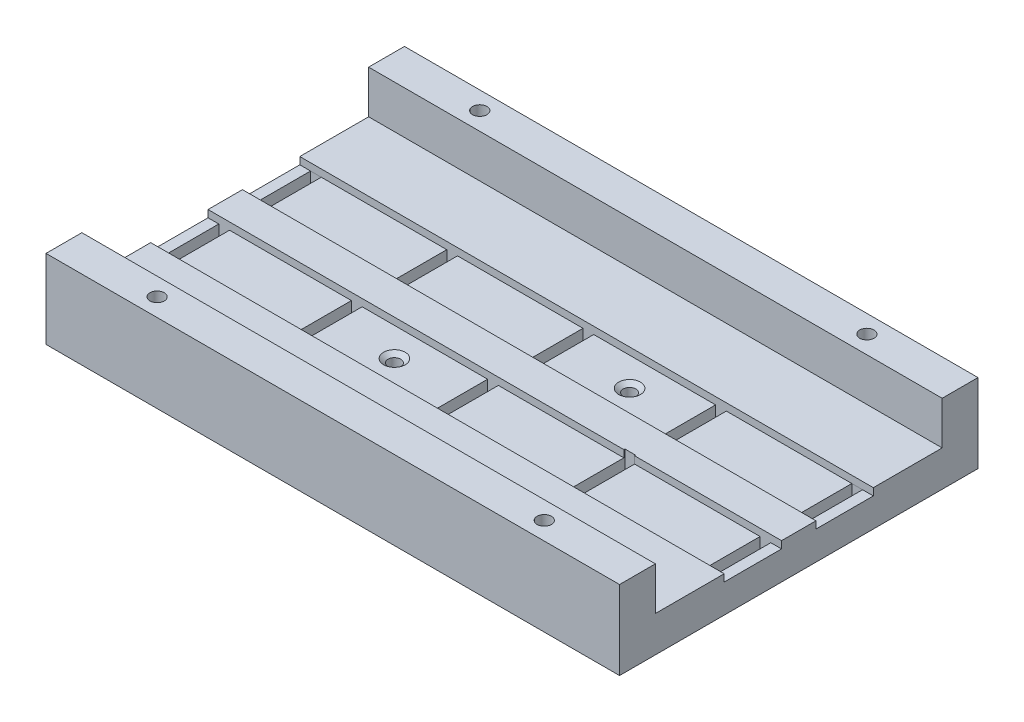
from build123d import *

# Parameters (mm, degrees)
SKETCH1_W                                         = 80
SKETCH1_H                                         = 50
BOSS_EXTRUDE2_DEPTH                               = 5
SKETCH2_W                                         = 80
SKETCH2_H                                         = 5
BOSS_EXTRUDE3_DEPTH                               = 6
SKETCH3_W                                         = 80
SKETCH3_H                                         = 8
CUT_EXTRUDE1_DEPTH                                = 1
CSK_FOR_0_FLAT_HEAD_MACHINE_SCREW_100_D           = 1.778
CSK_FOR_0_FLAT_HEAD_MACHINE_SCREW_100_CSINK_D     = 3.0226
CSK_FOR_0_FLAT_HEAD_MACHINE_SCREW_100_CSINK_ANGLE = 100
SKETCH14_W                                        = 1.5
SKETCH14_H                                        = 8.012608664
SKETCH14_H_2                                      = 8
CUT_EXTRUDE3_DEPTH                                = 10
SKETCH16_R                                        = 1
CUT_EXTRUDE4_DEPTH                                = 15
SKETCH18_W                                        = 1.5
SKETCH18_H                                        = 8
CUT_EXTRUDE5_DEPTH                                = 15
SKETCH19_W                                        = 1.5
SKETCH19_H                                        = 8.001374606
SKETCH19_H_2                                      = 8
CUT_EXTRUDE6_DEPTH                                = 15


with BuildPart() as part:
    # Sketch1 → Boss-Extrude2 (new body)
    with BuildSketch(Plane(origin=(0, 0, 0), x_dir=(1, 0, 0), z_dir=(0, 1, 0))):
        with Locations((40, 25)):
            Rectangle(SKETCH1_W, SKETCH1_H)
    extrude(amount=BOSS_EXTRUDE2_DEPTH)

    # Sketch2 → Boss-Extrude3 (add)
    with BuildSketch(Plane(origin=(0, 5, 0), x_dir=(1, 0, 0), z_dir=(0, 1, 0))):
        with Locations((40, 47.5)):
            Rectangle(SKETCH2_W, SKETCH2_H)
        with Locations((40, 2.5)):
            Rectangle(SKETCH2_W, SKETCH2_H)
    extrude(amount=BOSS_EXTRUDE3_DEPTH)

    # Sketch3 → Cut-Extrude1 (cut)
    with BuildSketch(Plane(origin=(0, 5, 0), x_dir=(1, 0, 0), z_dir=(0, 1, 0))):
        with Locations((40, 31.4)):
            Rectangle(SKETCH3_W, SKETCH3_H)
        with Locations((40, 18.6)):
            Rectangle(SKETCH3_W, SKETCH3_H)
    extrude(amount=-CUT_EXTRUDE1_DEPTH, mode=Mode.SUBTRACT)

    # CSK for _0 Flat Head Machine Screw _100 (through all)
    with Locations(Plane(origin=(30, 4, -18.6), x_dir=(0, 0, 1), z_dir=(0, 1, 0))):
        with Locations((0, 0), (-12.8, 20)):
            CounterSinkHole(CSK_FOR_0_FLAT_HEAD_MACHINE_SCREW_100_D / 2, CSK_FOR_0_FLAT_HEAD_MACHINE_SCREW_100_CSINK_D / 2, counter_sink_angle=CSK_FOR_0_FLAT_HEAD_MACHINE_SCREW_100_CSINK_ANGLE)

    # Sketch14 → Cut-Extrude3 (cut)
    with BuildSketch(Plane(origin=(0, 4, 0), x_dir=(1, 0, 0), z_dir=(0, 1, 0))):
        with Locations((77.75, 31.406304332)):
            Rectangle(SKETCH14_W, SKETCH14_H)
        with Locations((2.25, 31.406304332)):
            Rectangle(SKETCH14_W, SKETCH14_H)
        with Locations((2.25, 18.6)):
            Rectangle(SKETCH14_W, SKETCH14_H_2)
        with Locations((77.75, 18.6)):
            Rectangle(SKETCH14_W, SKETCH14_H_2)
    extrude(amount=-CUT_EXTRUDE3_DEPTH, mode=Mode.SUBTRACT)

    # Sketch16 → Cut-Extrude4 (cut)
    with BuildSketch(Plane(origin=(0, 11, 0), x_dir=(1, 0, 0), z_dir=(0, 1, 0))):
        with Locations((67, 2.5)):
            Circle(SKETCH16_R)
        with Locations((67, 47.5)):
            Circle(SKETCH16_R)
        with Locations((13, 2.5)):
            Circle(SKETCH16_R)
        with Locations((13, 47.5)):
            Circle(SKETCH16_R)
    extrude(amount=-CUT_EXTRUDE4_DEPTH, mode=Mode.SUBTRACT)

    # Sketch18 → Cut-Extrude5 (cut)
    with BuildSketch(Plane(origin=(0, 4, 0), x_dir=(1, 0, 0), z_dir=(0, 1, 0))):
        with Locations((39.75, 18.6)):
            Rectangle(SKETCH18_W, SKETCH18_H)
        with Locations((40.25, 31.4)):
            Rectangle(SKETCH18_W, SKETCH18_H)
    extrude(amount=-CUT_EXTRUDE5_DEPTH, mode=Mode.SUBTRACT)

    # Sketch19 → Cut-Extrude6 (cut)
    with BuildSketch(Plane.XZ):
        with Locations((58.75, -18.74801657)):
            Rectangle(SKETCH19_W, SKETCH19_H)
        with Locations((58.75, -31.4)):
            Rectangle(SKETCH19_W, SKETCH19_H_2)
        with Locations((21.25, -31.4)):
            Rectangle(SKETCH19_W, SKETCH19_H_2)
        with Locations((20.75, -18.6)):
            Rectangle(SKETCH19_W, SKETCH19_H_2)
    extrude(amount=-CUT_EXTRUDE6_DEPTH, mode=Mode.SUBTRACT)


solid = part.part
